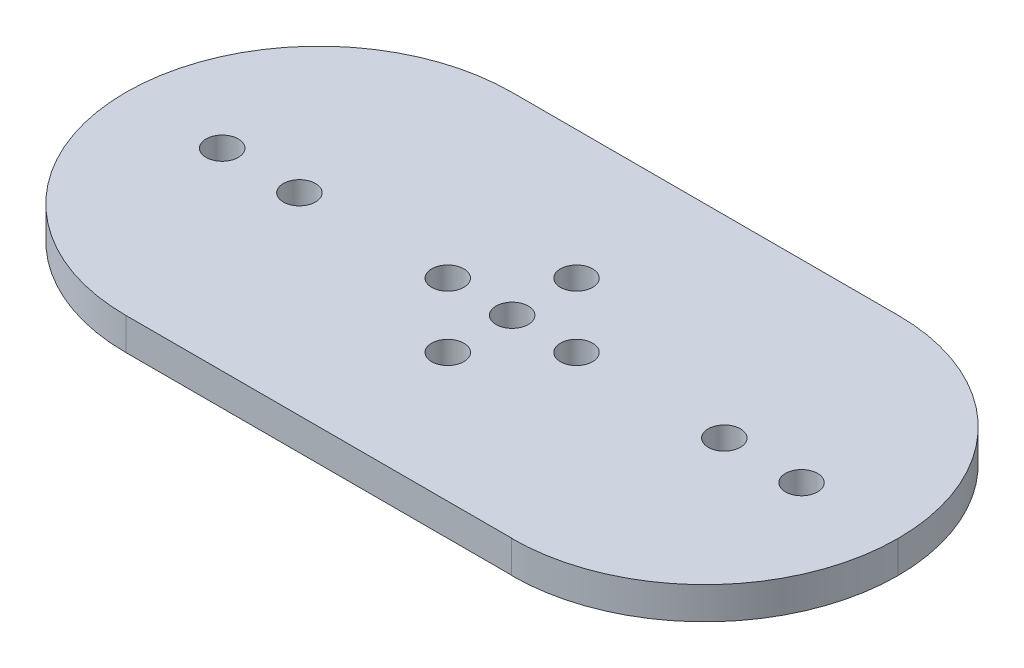
from build123d import *

# Parameters (mm, degrees)
SKETCH1_W           = 60
SKETCH1_H           = 60
SKETCH1_R           = 2.5
BOSS_EXTRUDE2_DEPTH = 5
SKETCH4_W           = 30
SKETCH4_H           = 60.044205022
SKETCH4_R           = 2.5
SKETCH4_H_2         = 60
BOSS_EXTRUDE5_DEPTH = 5
FILLET1_R           = 30


with BuildPart() as part:
    # Sketch1 → Boss-Extrude2 (new body)
    with BuildSketch(Plane(origin=(0, 0, 0), x_dir=(1, 0, 0), z_dir=(0, 1, 0))):
        with Locations((30, 30)):
            Rectangle(SKETCH1_W, SKETCH1_H)
        with Locations(Location((30, 40.020671676, 0), (0, 0, 270))):
            Circle(SKETCH1_R, mode=Mode.SUBTRACT)
        with Locations(Location((20, 30.020671676, 0), (0, 0, 270))):
            Circle(SKETCH1_R, mode=Mode.SUBTRACT)
        with Locations(Location((30, 20.020671676, 0), (0, 0, 270))):
            Circle(SKETCH1_R, mode=Mode.SUBTRACT)
        with Locations(Location((40, 30.020671676, 0), (0, 0, 270))):
            Circle(SKETCH1_R, mode=Mode.SUBTRACT)
        with Locations(Location((30, 30.020671676, 0), (0, 0, 270))):
            Circle(SKETCH1_R, mode=Mode.SUBTRACT)
    extrude(amount=BOSS_EXTRUDE2_DEPTH)

    # Sketch4 → Boss-Extrude5 (add)
    # profile 1 of 2: a face of its own
    with BuildSketch(Plane(origin=(0, 0, 0), x_dir=(1, 0, 0), z_dir=(0, 1, 0))):
        with Locations((75, 29.977897489)):
            Rectangle(SKETCH4_W, SKETCH4_H)
        with Locations(Location((63, 29.977897489, 0), (0, 0, 270))):
            Circle(SKETCH4_R, mode=Mode.SUBTRACT)
        with Locations(Location((75, 29.977897489, 0), (0, 0, 270))):
            Circle(SKETCH4_R, mode=Mode.SUBTRACT)
    # profile 2 of 2: a face of its own
    with BuildSketch(Plane(origin=(0, 0, 0), x_dir=(1, 0, 0), z_dir=(0, 1, 0))):
        with Locations((-15, 30)):
            Rectangle(SKETCH4_W, SKETCH4_H_2)
        with Locations(Location((-3, 29.977897489, 0), (0, 0, 270))):
            Circle(SKETCH4_R, mode=Mode.SUBTRACT)
        with Locations(Location((-15, 29.977897489, 0), (0, 0, 270))):
            Circle(SKETCH4_R, mode=Mode.SUBTRACT)
    extrude(amount=BOSS_EXTRUDE5_DEPTH)

    # Fillet1
    fillet1_edges = [part.edges().sort_by_distance(p)[0] for p in [
        (-30, 2.5, 0),
        (-30, 2.5, -60),
        (90, 2.5, 0.044205022),
        (90, 2.5, -60),
    ]]
    fillet(fillet1_edges, radius=FILLET1_R - 0.0001)  # a hair under: the kernel refuses the full size


solid = part.part
